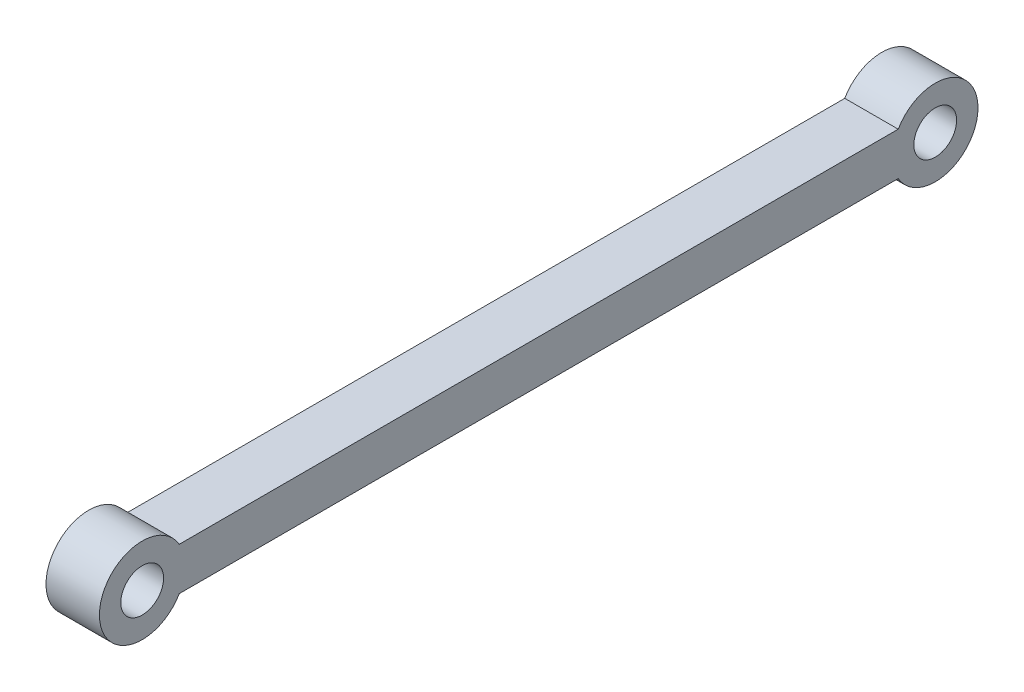
from build123d import *

# Parameters (mm, degrees)
SKETCH1_R           = 1
BOSS_EXTRUDE1_DEPTH = 1.25


with BuildPart() as part:
    # Sketch1 → Boss-Extrude1 (new, symmetric)
    with BuildSketch(Plane(origin=(0, 0, 0), x_dir=(0, 0, -1), z_dir=(1, 0, 0))):
        with BuildLine():
            Line((-16.815449192, 1), (16.815449192, 1))
            ThreePointArc((16.815449192, 1), (20.5475, 0), (16.815449192, -1))
            Line((16.815449192, -1), (-16.815449192, -1))
            ThreePointArc((-16.815449192, -1), (-20.5475, 0), (-16.815449192, 1))
        make_face()
        with Locations((-18.5475, 0)):
            Circle(SKETCH1_R, mode=Mode.SUBTRACT)
        with Locations((18.5475, 0)):
            Circle(SKETCH1_R, mode=Mode.SUBTRACT)
    extrude(amount=BOSS_EXTRUDE1_DEPTH, both=True)


solid = part.part
